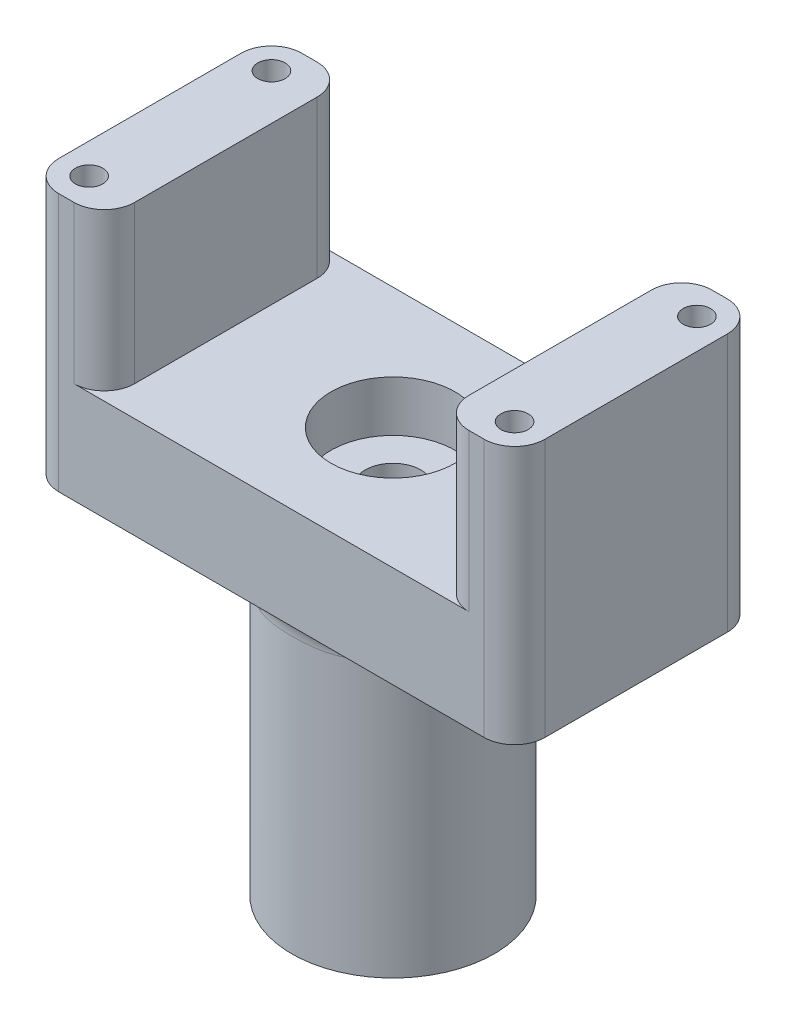
from build123d import *

# Parameters (mm, degrees)
SKETCH1_R                               = 1.35
BOSS_EXTRUDE1_DEPTH                     = 15.5
BOSS_EXTRUDE1_2_DEPTH                   = 15.5
BOSS_EXTRUDE2_START                     = -10
SKETCH2_R                               = 1.35
BOSS_EXTRUDE2_DEPTH                     = 10
SKETCH4_R                               = 10
BOSS_EXTRUDE3_DEPTH                     = 30
CBORE_FOR_M5_HEX_HEAD_BOLT1_D           = 5.5
CBORE_FOR_M5_HEX_HEAD_BOLT1_CBORE_D     = 12.24
CBORE_FOR_M5_HEX_HEAD_BOLT1_CBORE_DEPTH = 5
FILLET1_R                               = 3


with BuildPart() as part:
    # Sketch1 → Boss-Extrude1 (new body)
    with BuildSketch(Plane(origin=(0, 0, 0), x_dir=(1, 0, 0), z_dir=(0, 1, 0))):
        with BuildLine():
            Line((21, 12), (16.5, 12))
            Line((16.5, 12), (16.5, -12))
            Line((16.5, -12), (21, -12))
            ThreePointArc((21, -12), (23.121320344, -11.121320344), (24, -9))
            Line((24, -9), (24, 9))
            ThreePointArc((24, 9), (23.121320344, 11.121320344), (21, 12))
        make_face()
        with Locations((21, -9)):
            Circle(SKETCH1_R, mode=Mode.SUBTRACT)
        with Locations((21, 9)):
            Circle(SKETCH1_R, mode=Mode.SUBTRACT)
    extrude(amount=BOSS_EXTRUDE1_DEPTH)



with BuildPart() as body_2:
    # Sketch1 → Boss-Extrude1 2 (new body)
    with BuildSketch(Plane(origin=(0, 0, 0), x_dir=(1, 0, 0), z_dir=(0, 1, 0))):
        with BuildLine():
            Line((-16.5, 12), (-21, 12))
            ThreePointArc((-21, 12), (-23.121320344, 11.121320344), (-24, 9))
            Line((-24, 9), (-24, -9))
            ThreePointArc((-24, -9), (-23.121320344, -11.121320344), (-21, -12))
            Line((-21, -12), (-16.5, -12))
            Line((-16.5, -12), (-16.5, 12))
        make_face()
        with Locations((-21, -9)):
            Circle(SKETCH1_R, mode=Mode.SUBTRACT)
        with Locations((-21, 9)):
            Circle(SKETCH1_R, mode=Mode.SUBTRACT)
    extrude(amount=BOSS_EXTRUDE1_2_DEPTH)


with BuildPart() as part_1:
    add(part.part)

    add(body_2.part)  # Boss-Extrude2 merges body 2
    # Sketch2 → Boss-Extrude2 (add)
    with BuildSketch(Plane(origin=(0, 0, 0), x_dir=(1, 0, 0), z_dir=(0, 1, 0)).offset(BOSS_EXTRUDE2_START)):
        with BuildLine():
            Line((24, 9), (24, -9))
            ThreePointArc((24, -9), (23.121320344, -11.121320344), (21, -12))
            Line((21, -12), (16.5, -12))
            Line((16.5, -12), (-16.5, -12))
            Line((-16.5, -12), (-21, -12))
            ThreePointArc((-21, -12), (-23.121320344, -11.121320344), (-24, -9))
            Line((-24, -9), (-24, 9))
            ThreePointArc((-24, 9), (-23.121320344, 11.121320344), (-21, 12))
            Line((-21, 12), (-16.5, 12))
            Line((-16.5, 12), (16.5, 12))
            Line((16.5, 12), (21, 12))
            ThreePointArc((21, 12), (23.121320344, 11.121320344), (24, 9))
        make_face()
        with Locations((21, 9)):
            Circle(SKETCH2_R, mode=Mode.SUBTRACT)
        with Locations((21, -9)):
            Circle(SKETCH2_R, mode=Mode.SUBTRACT)
        with Locations((-21, 9)):
            Circle(SKETCH2_R, mode=Mode.SUBTRACT)
        with Locations((-21, -9)):
            Circle(SKETCH2_R, mode=Mode.SUBTRACT)
    extrude(amount=BOSS_EXTRUDE2_DEPTH)

    # Sketch4 → Boss-Extrude3 (add)
    with BuildSketch(Plane.XZ.offset(10)):
        Circle(SKETCH4_R)
    extrude(amount=BOSS_EXTRUDE3_DEPTH)

    # CBORE for M5 Hex Head Bolt1 (through all)
    with Locations(Plane.ZX):
        with Locations((0, 0)):
            CounterBoreHole(CBORE_FOR_M5_HEX_HEAD_BOLT1_D / 2, CBORE_FOR_M5_HEX_HEAD_BOLT1_CBORE_D / 2, CBORE_FOR_M5_HEX_HEAD_BOLT1_CBORE_DEPTH)

    # Fillet1
    fillet1_edges = [part_1.edges().sort_by_distance(p)[0] for p in [
        (16.5, 7.75, -12),
        (16.5, 7.75, 12),
        (-16.5, 7.75, -12),
        (-16.5, 7.75, 12),
        (-10, -10, 0),
    ]]
    fillet(fillet1_edges, radius=FILLET1_R)


solid = part_1.part
